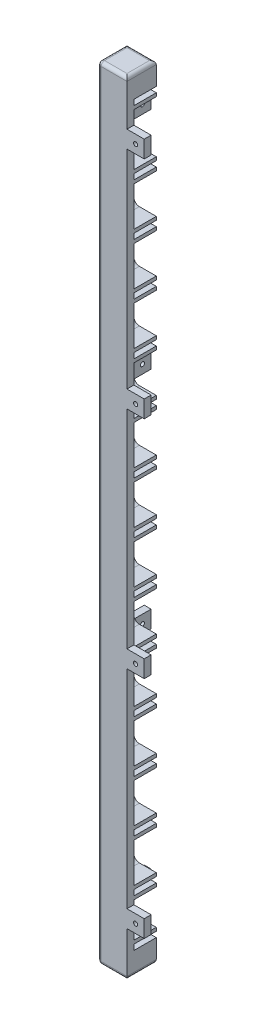
from build123d import *

# Parameters (mm, degrees)
BOSS_EXTRUDE1_DEPTH            = 227
FILLET1_R                      = 1
SKETCH2_W                      = 2
SKETCH2_H                      = 5
BOSS_EXTRUDE2_DEPTH            = 5
F_0_80_TAPPED_HOLE2_AT_2_COUNT = 2
F_0_80_TAPPED_HOLE2_AT_2_PITCH = 65.333333333
F_0_80_TAPPED_HOLE2_AT_3_COUNT = 2
F_0_80_TAPPED_HOLE2_AT_3_PITCH = 130.666666667
F_0_80_TAPPED_HOLE2_AT_4_COUNT = 2
F_0_80_TAPPED_HOLE2_AT_4_PITCH = 196
CUT_EXTRUDE1_START             = -6.5
SKETCH3_W                      = 6.5
SKETCH3_H                      = 6.5
CUT_EXTRUDE1_DEPTH             = 214
SKETCH7_W                      = 6.5
SKETCH7_H                      = 1
BOSS_EXTRUDE5_DEPTH            = 6.5
FILLET4_R                      = 0.5
FILLET5_START                  = -4.25
FILLET5_DEPTH                  = 7.25
FILLET5_START_2                = -9.25
FILLET5_2_DEPTH                = 5
SKETCH8_OUTSIDE_W              = 61.06
SKETCH8_OUTSIDE_H              = 274.56
SKETCH8_OUTSIDE_W_2            = 2
SKETCH8_OUTSIDE_H_2            = 5
CUT_EXTRUDE2_DEPTH             = 5


with BuildPart() as part:
    # Sketch1 → Boss-Extrude1 (new body)
    with BuildSketch(Plane(origin=(0, 0, 0), x_dir=(1, 0, 0), z_dir=(0, 1, 0))):
        with BuildLine():
            Line((-3.25, -4.25), (4.25, -4.25))
            Line((4.25, -4.25), (4.25, 4.25))
            Line((4.25, 4.25), (-4.25, 4.25))
            Line((-4.25, 4.25), (-4.25, -3.25))
            ThreePointArc((-4.25, -3.25), (-3.957106781, -3.957106781), (-3.25, -4.25))
        make_face()
    extrude(amount=BOSS_EXTRUDE1_DEPTH)

    # Fillet1
    fillet1_edges = [part.edges().sort_by_distance(p)[0] for p in [
        (-4.25, 227, -0.5),
        (-3.957106781, 227, 3.957106781),
        (0.5, 227, 4.25),
        (4.25, 227, 0),
        (0.5, 0, 4.25),
        (-3.957106781, 0, 3.957106781),
        (-4.25, 0, -0.5),
        (0, 0, -4.25),
        (4.25, 0, 0),
        (0, 227, -4.25),
    ]]
    fillet(fillet1_edges, radius=FILLET1_R)

    # Sketch2 → Boss-Extrude2 (add)
    with BuildSketch(Plane(origin=(4.25, 0, 0), x_dir=(0, 0, -1), z_dir=(1, 0, 0))):
        with Locations((-3.25, 211.5)):
            Rectangle(SKETCH2_W, SKETCH2_H)
        with Locations((-3.25, 15.5)):
            Rectangle(SKETCH2_W, SKETCH2_H)
        with Locations((-3.25, 146.166666667)):
            Rectangle(SKETCH2_W, SKETCH2_H)
        with Locations((-3.25, 80.833333333)):
            Rectangle(SKETCH2_W, SKETCH2_H)
    boss_extrude2 = extrude(amount=BOSS_EXTRUDE2_DEPTH)

    # Sketch10 → #0-80 Tapped Hole2 (revolve, cut)
    with BuildSketch(Plane(origin=(6.75, 211.5, 4.25), x_dir=(0, -1, 0), z_dir=(1, 0, 0))):
        Polygon((0, 0), (0, 4.358390611), (0.59563, 4.0005), (0.59563, 0), align=None)
    f_0_80_tapped_hole2 = revolve(axis=Axis((6.75, 211.5, 10.6), (0, 0, -1)), mode=Mode.SUBTRACT)

    # #0-80 Tapped Hole2 at 2: #0-80 Tapped Hole2 ×2
    with Locations(*[(0, -i * F_0_80_TAPPED_HOLE2_AT_2_PITCH, 0) for i in range(1, F_0_80_TAPPED_HOLE2_AT_2_COUNT)]):
        add(f_0_80_tapped_hole2, mode=Mode.SUBTRACT)

    # #0-80 Tapped Hole2 at 3: #0-80 Tapped Hole2 ×2
    with Locations(*[(0, -i * F_0_80_TAPPED_HOLE2_AT_3_PITCH, 0) for i in range(1, F_0_80_TAPPED_HOLE2_AT_3_COUNT)]):
        add(f_0_80_tapped_hole2, mode=Mode.SUBTRACT)

    # #0-80 Tapped Hole2 at 4: #0-80 Tapped Hole2 ×2
    with Locations(*[(0, -i * F_0_80_TAPPED_HOLE2_AT_4_PITCH, 0) for i in range(1, F_0_80_TAPPED_HOLE2_AT_4_COUNT)]):
        add(f_0_80_tapped_hole2, mode=Mode.SUBTRACT)

    # Mirror1: Boss-Extrude2, #0-80 Tapped Hole2 across plane
    add(boss_extrude2.mirror(Plane(origin=(0, 0, 0), x_dir=(-0.7071067811865478, 0, 0.7071067811865472), z_dir=(-0.7071067811865475, 0, -0.7071067811865477))))
    add(f_0_80_tapped_hole2.mirror(Plane(origin=(0, 0, 0), x_dir=(-0.7071067811865478, 0, 0.7071067811865472), z_dir=(-0.7071067811865475, 0, -0.7071067811865477))), mode=Mode.SUBTRACT)

    # Mirror1 copy 1 sketch → Mirror1 copy 1 (revolve, cut)
    with BuildSketch(Plane(origin=(-4.25, 146.166666667, -6.75), x_dir=(0, -1, 0), z_dir=(0, 0, -1))):
        Polygon((0, 0), (0, -4.358390611), (0.59563, -4.0005), (0.59563, 0), align=None)
    revolve(axis=Axis((-10.6, 146.166666667, -6.75), (-1, 0, 0)), mode=Mode.SUBTRACT)

    # Mirror1 copy 2 sketch → Mirror1 copy 2 (revolve, cut)
    with BuildSketch(Plane(origin=(-4.25, 80.833333333, -6.75), x_dir=(0, -1, 0), z_dir=(0, 0, -1))):
        Polygon((0, 0), (0, -4.358390611), (0.59563, -4.0005), (0.59563, 0), align=None)
    revolve(axis=Axis((-10.6, 80.833333333, -6.75), (-1, 0, 0)), mode=Mode.SUBTRACT)

    # Mirror1 copy 3 sketch → Mirror1 copy 3 (revolve, cut)
    with BuildSketch(Plane(origin=(-4.25, 15.5, -6.75), x_dir=(0, -1, 0), z_dir=(0, 0, -1))):
        Polygon((0, 0), (0, -4.358390611), (0.59563, -4.0005), (0.59563, 0), align=None)
    revolve(axis=Axis((-10.6, 15.5, -6.75), (-1, 0, 0)), mode=Mode.SUBTRACT)

    # Sketch3 → Cut-Extrude1 (cut)
    with BuildSketch(Plane(origin=(0, 227, 0), x_dir=(1, 0, 0), z_dir=(0, 1, 0)).offset(CUT_EXTRUDE1_START)):
        with Locations((1, 1)):
            Rectangle(SKETCH3_W, SKETCH3_H)
    extrude(amount=-CUT_EXTRUDE1_DEPTH, mode=Mode.SUBTRACT)

    # Sketch7 → Boss-Extrude5 (add)
    with BuildSketch(Plane(origin=(0, 0, 2.25), x_dir=(-1, 0, 0), z_dir=(0, 0, -1))):
        with Locations((-1, 202.325)):
            Rectangle(SKETCH7_W, SKETCH7_H)
        with Locations((-1, 199.7375)):
            Rectangle(SKETCH7_W, SKETCH7_H)
        with Locations((-1, 187.325)):
            Rectangle(SKETCH7_W, SKETCH7_H)
        with Locations((-1, 184.7375)):
            Rectangle(SKETCH7_W, SKETCH7_H)
        with Locations((-1, 172.325)):
            Rectangle(SKETCH7_W, SKETCH7_H)
        with Locations((-1, 169.7375)):
            Rectangle(SKETCH7_W, SKETCH7_H)
        with Locations((-1, 157.325)):
            Rectangle(SKETCH7_W, SKETCH7_H)
        with Locations((-1, 154.7375)):
            Rectangle(SKETCH7_W, SKETCH7_H)
        with Locations((-1, 142.325)):
            Rectangle(SKETCH7_W, SKETCH7_H)
        with Locations((-1, 139.7375)):
            Rectangle(SKETCH7_W, SKETCH7_H)
        with Locations((-1, 127.325)):
            Rectangle(SKETCH7_W, SKETCH7_H)
        with Locations((-1, 124.7375)):
            Rectangle(SKETCH7_W, SKETCH7_H)
        with Locations((-1, 112.325)):
            Rectangle(SKETCH7_W, SKETCH7_H)
        with Locations((-1, 109.7375)):
            Rectangle(SKETCH7_W, SKETCH7_H)
        with Locations((-1, 97.325)):
            Rectangle(SKETCH7_W, SKETCH7_H)
        with Locations((-1, 94.7375)):
            Rectangle(SKETCH7_W, SKETCH7_H)
        with Locations((-1, 82.325)):
            Rectangle(SKETCH7_W, SKETCH7_H)
        with Locations((-1, 79.7375)):
            Rectangle(SKETCH7_W, SKETCH7_H)
        with Locations((-1, 67.325)):
            Rectangle(SKETCH7_W, SKETCH7_H)
        with Locations((-1, 64.7375)):
            Rectangle(SKETCH7_W, SKETCH7_H)
        with Locations((-1, 52.325)):
            Rectangle(SKETCH7_W, SKETCH7_H)
        with Locations((-1, 49.7375)):
            Rectangle(SKETCH7_W, SKETCH7_H)
        with Locations((-1, 37.325)):
            Rectangle(SKETCH7_W, SKETCH7_H)
        with Locations((-1, 34.7375)):
            Rectangle(SKETCH7_W, SKETCH7_H)
        with Locations((-1, 22.325)):
            Rectangle(SKETCH7_W, SKETCH7_H)
        with Locations((-1, 19.7375)):
            Rectangle(SKETCH7_W, SKETCH7_H)
        with Locations((-1, 8.5875)):
            Rectangle(SKETCH7_W, SKETCH7_H)
        with Locations((-1, 218.4125)):
            Rectangle(SKETCH7_W, SKETCH7_H)
    extrude(amount=BOSS_EXTRUDE5_DEPTH)

    # Fillet4
    fillet4_edges = [part.edges().sort_by_distance(p)[0] for p in [
        (-2.25, 220.5, -1),
        (-2.25, 6.5, -1),
        (-2.25, 8.0875, -1),
        (-2.25, 201.825, -1),
        (-2.25, 200.2375, -1),
        (-2.25, 186.825, -1),
        (-2.25, 185.2375, -1),
        (-2.25, 171.825, -1),
        (-2.25, 170.2375, -1),
        (-2.25, 156.825, -1),
        (-2.25, 155.2375, -1),
        (-2.25, 141.825, -1),
        (-2.25, 140.2375, -1),
        (-2.25, 126.825, -1),
        (-2.25, 125.2375, -1),
        (-2.25, 111.825, -1),
        (-2.25, 110.2375, -1),
        (-2.25, 96.825, -1),
        (-2.25, 95.2375, -1),
        (-2.25, 81.825, -1),
        (-2.25, 80.2375, -1),
        (-2.25, 66.825, -1),
        (-2.25, 65.2375, -1),
        (-2.25, 51.825, -1),
        (-2.25, 50.2375, -1),
        (-2.25, 36.825, -1),
        (-2.25, 35.2375, -1),
        (-2.25, 21.825, -1),
        (-2.25, 20.2375, -1),
        (-2.25, 218.9125, -1),
    ]]
    fillet(fillet4_edges, radius=FILLET4_R)

    # Fillet5: read off the stored shape, not the designer's step
    # Fillet5 outline → Fillet5 (add)
    with BuildSketch(Plane.XY.offset(FILLET5_START)):
        with BuildLine():
            Line((-2.25, 144.4125), (-2.25, 142.825))
            Line((-2.25, 142.825), (-0.6625, 142.825))
            ThreePointArc((-0.6625, 142.825), (-1.785032015, 143.289967985), (-2.25, 144.4125))
        make_face()
        with BuildLine():
            Line((-2.25, 154.2375), (-2.25, 152.65))
            ThreePointArc((-2.25, 152.65), (-1.785032015, 153.772532015), (-0.6625, 154.2375))
            Line((-0.6625, 154.2375), (-2.25, 154.2375))
        make_face()
        with BuildLine():
            ThreePointArc((-0.6625, 9.0875), (-1.785032015, 9.552467985), (-2.25, 10.675))
            Line((-2.25, 10.675), (-2.25, 9.0875))
            Line((-2.25, 9.0875), (-0.6625, 9.0875))
        make_face()
        with BuildLine():
            ThreePointArc((-2.25, 17.65), (-1.785032015, 18.772532015), (-0.6625, 19.2375))
            Line((-0.6625, 19.2375), (-2.25, 19.2375))
            Line((-2.25, 19.2375), (-2.25, 17.65))
        make_face()
        with BuildLine():
            ThreePointArc((-0.6625, 202.825), (-1.785032015, 203.289967985), (-2.25, 204.4125))
            Line((-2.25, 204.4125), (-2.25, 202.825))
            Line((-2.25, 202.825), (-0.6625, 202.825))
        make_face()
        with BuildLine():
            ThreePointArc((-2.25, 216.325), (-1.785032015, 217.447532015), (-0.6625, 217.9125))
            Line((-0.6625, 217.9125), (-2.25, 217.9125))
            Line((-2.25, 217.9125), (-2.25, 216.325))
        make_face()
        with BuildLine():
            ThreePointArc((-0.6625, 187.825), (-1.785032015, 188.289967985), (-2.25, 189.4125))
            Line((-2.25, 189.4125), (-2.25, 187.825))
            Line((-2.25, 187.825), (-0.6625, 187.825))
        make_face()
        with BuildLine():
            ThreePointArc((-2.25, 197.65), (-1.785032015, 198.772532015), (-0.6625, 199.2375))
            Line((-0.6625, 199.2375), (-2.25, 199.2375))
            Line((-2.25, 199.2375), (-2.25, 197.65))
        make_face()
        with BuildLine():
            ThreePointArc((-0.6625, 172.825), (-1.785032015, 173.289967985), (-2.25, 174.4125))
            Line((-2.25, 174.4125), (-2.25, 172.825))
            Line((-2.25, 172.825), (-0.6625, 172.825))
        make_face()
        with BuildLine():
            ThreePointArc((-2.25, 182.65), (-1.785032015, 183.772532015), (-0.6625, 184.2375))
            Line((-0.6625, 184.2375), (-2.25, 184.2375))
            Line((-2.25, 184.2375), (-2.25, 182.65))
        make_face()
        with BuildLine():
            ThreePointArc((-0.6625, 157.825), (-1.785032015, 158.289967985), (-2.25, 159.4125))
            Line((-2.25, 159.4125), (-2.25, 157.825))
            Line((-2.25, 157.825), (-0.6625, 157.825))
        make_face()
        with BuildLine():
            Line((-2.25, 169.2375), (-2.25, 167.65))
            ThreePointArc((-2.25, 167.65), (-1.785032015, 168.772532015), (-0.6625, 169.2375))
            Line((-0.6625, 169.2375), (-2.25, 169.2375))
        make_face()
        with BuildLine():
            ThreePointArc((-0.6625, 127.825), (-1.785032015, 128.289967985), (-2.25, 129.4125))
            Line((-2.25, 129.4125), (-2.25, 127.825))
            Line((-2.25, 127.825), (-0.6625, 127.825))
        make_face()
        with BuildLine():
            ThreePointArc((-2.25, 137.65), (-1.785032015, 138.772532015), (-0.6625, 139.2375))
            Line((-0.6625, 139.2375), (-2.25, 139.2375))
            Line((-2.25, 139.2375), (-2.25, 137.65))
        make_face()
        with BuildLine():
            ThreePointArc((-0.6625, 112.825), (-1.785032015, 113.289967985), (-2.25, 114.4125))
            Line((-2.25, 114.4125), (-2.25, 112.825))
            Line((-2.25, 112.825), (-0.6625, 112.825))
        make_face()
        with BuildLine():
            ThreePointArc((-2.25, 122.65), (-1.785032015, 123.772532015), (-0.6625, 124.2375))
            Line((-0.6625, 124.2375), (-2.25, 124.2375))
            Line((-2.25, 124.2375), (-2.25, 122.65))
        make_face()
        with BuildLine():
            ThreePointArc((-0.6625, 97.825), (-1.785032015, 98.289967985), (-2.25, 99.4125))
            Line((-2.25, 99.4125), (-2.25, 97.825))
            Line((-2.25, 97.825), (-0.6625, 97.825))
        make_face()
        with BuildLine():
            ThreePointArc((-2.25, 107.65), (-1.785032015, 108.772532015), (-0.6625, 109.2375))
            Line((-0.6625, 109.2375), (-2.25, 109.2375))
            Line((-2.25, 109.2375), (-2.25, 107.65))
        make_face()
        with BuildLine():
            ThreePointArc((-0.6625, 67.825), (-1.785032015, 68.289967985), (-2.25, 69.4125))
            Line((-2.25, 69.4125), (-2.25, 67.825))
            Line((-2.25, 67.825), (-0.6625, 67.825))
        make_face()
        with BuildLine():
            Line((-0.6625, 79.2375), (-2.25, 79.2375))
            Line((-2.25, 79.2375), (-2.25, 77.65))
            ThreePointArc((-2.25, 77.65), (-1.785032015, 78.772532015), (-0.6625, 79.2375))
        make_face()
        with BuildLine():
            ThreePointArc((-0.6625, 82.825), (-1.785032015, 83.289967985), (-2.25, 84.4125))
            Line((-2.25, 84.4125), (-2.25, 82.825))
            Line((-2.25, 82.825), (-0.6625, 82.825))
        make_face()
        with BuildLine():
            ThreePointArc((-2.25, 92.65), (-1.785032015, 93.772532015), (-0.6625, 94.2375))
            Line((-0.6625, 94.2375), (-2.25, 94.2375))
            Line((-2.25, 94.2375), (-2.25, 92.65))
        make_face()
        with BuildLine():
            ThreePointArc((-0.6625, 52.825), (-1.785032015, 53.289967985), (-2.25, 54.4125))
            Line((-2.25, 54.4125), (-2.25, 52.825))
            Line((-2.25, 52.825), (-0.6625, 52.825))
        make_face()
        with BuildLine():
            Line((-2.25, 64.2375), (-2.25, 62.65))
            ThreePointArc((-2.25, 62.65), (-1.785032015, 63.772532015), (-0.6625, 64.2375))
            Line((-0.6625, 64.2375), (-2.25, 64.2375))
        make_face()
        with BuildLine():
            ThreePointArc((-0.6625, 37.825), (-1.785032015, 38.289967985), (-2.25, 39.4125))
            Line((-2.25, 39.4125), (-2.25, 37.825))
            Line((-2.25, 37.825), (-0.6625, 37.825))
        make_face()
        with BuildLine():
            Line((-2.25, 49.2375), (-2.25, 47.65))
            ThreePointArc((-2.25, 47.65), (-1.785032015, 48.772532015), (-0.6625, 49.2375))
            Line((-0.6625, 49.2375), (-2.25, 49.2375))
        make_face()
        with BuildLine():
            ThreePointArc((-0.6625, 22.825), (-1.785032015, 23.289967985), (-2.25, 24.4125))
            Line((-2.25, 24.4125), (-2.25, 22.825))
            Line((-2.25, 22.825), (-0.6625, 22.825))
        make_face()
        with BuildLine():
            ThreePointArc((-2.25, 32.65), (-1.785032015, 33.772532015), (-0.6625, 34.2375))
            Line((-0.6625, 34.2375), (-2.25, 34.2375))
            Line((-2.25, 34.2375), (-2.25, 32.65))
        make_face()
    extrude(amount=FILLET5_DEPTH)

    # Fillet5 2 outline → Fillet5 2 (add)
    with BuildSketch(Plane.XY.offset(FILLET5_START_2)):
        with BuildLine():
            ThreePointArc((-2.063888201, 143.666666667), (-2.20276946, 144.028148285), (-2.25, 144.4125))
            Line((-2.25, 144.4125), (-2.25, 143.666666667))
            Line((-2.25, 143.666666667), (-2.063888201, 143.666666667))
        make_face()
        with BuildLine():
            Line((-2.25, 18), (-2.25, 17.65))
            ThreePointArc((-2.25, 17.65), (-2.240203953, 17.826086584), (-2.210936712, 18))
            Line((-2.210936712, 18), (-2.25, 18))
        make_face()
    extrude(amount=FILLET5_2_DEPTH)

    # Sketch8 outside → Cut-Extrude2 (cut)
    with BuildSketch(Plane(origin=(0, 0, -9.25), x_dir=(-1, 0, 0), z_dir=(0, 0, -1))):
        with Locations((-2.5, 113.5)):
            Rectangle(SKETCH8_OUTSIDE_W, SKETCH8_OUTSIDE_H)
        with Locations((3.25, 15.5)):
            Rectangle(SKETCH8_OUTSIDE_W_2, SKETCH8_OUTSIDE_H_2, mode=Mode.SUBTRACT)
        with Locations((3.25, 211.5)):
            Rectangle(SKETCH8_OUTSIDE_W_2, SKETCH8_OUTSIDE_H_2, mode=Mode.SUBTRACT)
        with Locations((3.25, 146.166666667)):
            Rectangle(SKETCH8_OUTSIDE_W_2, SKETCH8_OUTSIDE_H_2, mode=Mode.SUBTRACT)
        with Locations((3.25, 80.833333333)):
            Rectangle(SKETCH8_OUTSIDE_W_2, SKETCH8_OUTSIDE_H_2, mode=Mode.SUBTRACT)
    extrude(amount=-CUT_EXTRUDE2_DEPTH, mode=Mode.SUBTRACT)


solid = part.part
